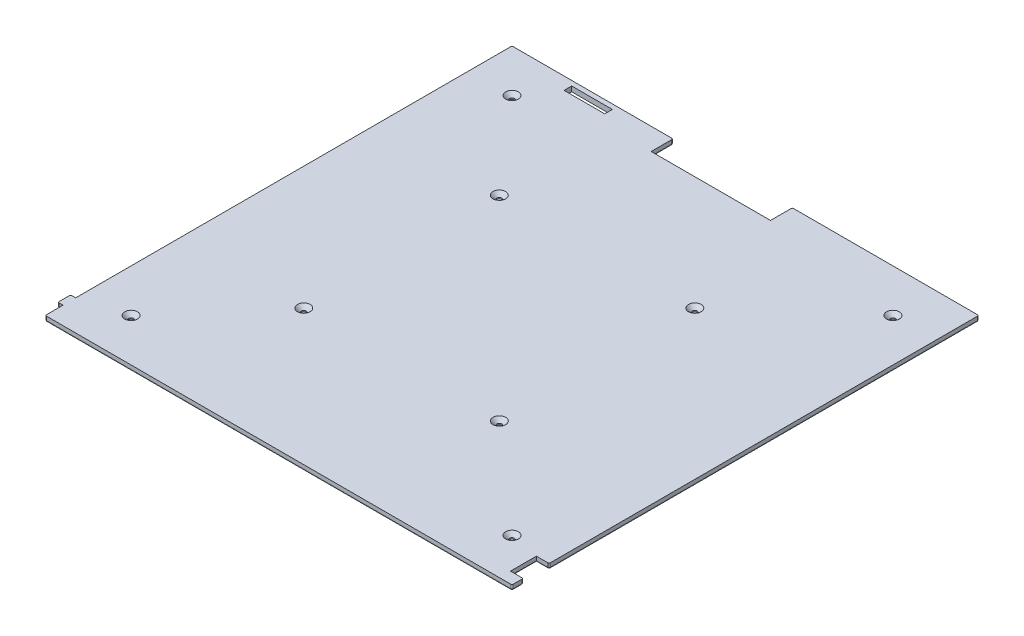
from build123d import *

# Parameters (mm, degrees)
BOSS_EXTRUDE1_DEPTH = 2
SKETCH2_R           = 1
CUT_EXTRUDE1_DEPTH  = 136.739493148
CHAMFER1_SIZE       = 1.5
CHAMFER2_SIZE       = 1.5
FILLET1_R           = 0.5
FILLET2_R           = 0.5
SKETCH3_W           = 16
SKETCH3_H           = 3
CUT_EXTRUDE2_DEPTH  = 136.739493148


with BuildPart() as part:
    # Sketch1 → Boss-Extrude1 (new body)
    with BuildSketch(Plane(origin=(0, 0, 0), x_dir=(1, 0, 0), z_dir=(0, 1, 0))):
        Polygon((-91.9, 85.8), (-91.9, -86), (-93.9, -86), (-93.9, -91), (-91.9, -91), (-91.9, -98), (91.9, -98), (91.9, -93.6), (86.9, -93.6), (86.9, -83.4), (91.9, -83.4), (91.9, 85.8), (18.5, 85.8), (18.5, 77.2), (-28.5, 77.2), (-28.5, 85.8), align=None)
    extrude(amount=BOSS_EXTRUDE1_DEPTH)

    # Sketch2 → Cut-Extrude1 (cut, through all)
    with BuildSketch(Plane.XZ):
        with Locations(Location((75, -68.9, 0), (0, 0, 270))):
            Circle(SKETCH2_R)
        with Locations(Location((-75, -68.9, 0), (0, 0, 270))):
            Circle(SKETCH2_R)
        with Locations(Location((-75, 81.1, 0), (0, 0, 270))):
            Circle(SKETCH2_R)
        with Locations(Location((75, 81.1, 0), (0, 0, 270))):
            Circle(SKETCH2_R)
        with Locations(Location((33.5, -32.4, 0), (0, 0, 270))):
            Circle(SKETCH2_R)
        with Locations(Location((-43.5, -32.4, 0), (0, 0, 270))):
            Circle(SKETCH2_R)
        with Locations(Location((-43.5, 44.6, 0), (0, 0, 270))):
            Circle(SKETCH2_R)
        with Locations(Location((33.5, 44.6, 0), (0, 0, 270))):
            Circle(SKETCH2_R)
    extrude(amount=-CUT_EXTRUDE1_DEPTH, mode=Mode.SUBTRACT)

    # Chamfer1
    chamfer1_edges = [part.edges().sort_by_distance(p)[0] for p in [
        (-75, 2, -67.9),
    ]]
    chamfer(chamfer1_edges, length=CHAMFER1_SIZE)

    # Chamfer2
    chamfer2_edges = [part.edges().sort_by_distance(p)[0] for p in [
        (-75, 2, 82.1),
        (75, 2, 82.1),
        (33.5, 2, -31.4),
        (-43.5, 2, -31.4),
        (-43.5, 2, 45.6),
        (33.5, 2, 45.6),
        (75, 2, -67.9),
    ]]
    chamfer(chamfer2_edges, length=CHAMFER2_SIZE)

    # Fillet1
    fillet1_edges = [part.edges().sort_by_distance(p)[0] for p in [
        (-28.5, 0, -81.5),
        (-5, 0, -77.2),
        (18.5, 0, -81.5),
        (55.2, 0, -85.8),
        (91.9, 0, -1.2),
        (89.4, 0, 83.4),
        (86.9, 0, 88.5),
        (89.4, 0, 93.6),
        (91.9, 0, 95.8),
        (0, 0, 98),
        (-91.9, 0, 94.5),
        (-92.9, 0, 91),
        (-93.9, 0, 88.5),
        (-92.9, 0, 86),
        (-91.9, 0, 0.1),
        (-60.2, 0, -85.8),
    ]]
    fillet(fillet1_edges, radius=FILLET1_R)

    # Fillet2
    # the kernel refuses this fillet: 0.5 mm, written as the material it takes off along each edge
    with BuildSketch(Plane(origin=(91.4, 0.5, 82.9), x_dir=(0, 0, 1), z_dir=(1, 0, 0))) as fillet2_piece_1_section:
        Polygon((0, 0), (FILLET2_R, 0), (FILLET2_R, FILLET2_R), (0, FILLET2_R), align=None)
    fillet2_piece_1 = extrude(amount=FILLET2_R, mode=Mode.PRIVATE)
    fillet2_piece_1 = fillet2_piece_1 - Plane(origin=(91.4, 0.5, 82.9), x_dir=(0, 0.7071067811865475, -0.7071067811865475), z_dir=(1, 0, 0)) * Sphere(FILLET2_R, mode=Mode.PRIVATE)
    add(fillet2_piece_1, mode=Mode.SUBTRACT)
    with BuildSketch(Plane(origin=(91.4, 0.5, 94.1), x_dir=(0, 0, -1), z_dir=(1, 0, 0))) as fillet2_piece_2_section:
        Polygon((0, 0), (FILLET2_R, 0), (FILLET2_R, -FILLET2_R), (0, -FILLET2_R), align=None)
    fillet2_piece_2 = extrude(amount=FILLET2_R, mode=Mode.PRIVATE)
    fillet2_piece_2 = fillet2_piece_2 - Plane(origin=(91.4, 0.5, 94.1), x_dir=(0, 0.7071067811865475, 0.7071067811865475), z_dir=(1, 0, 0)) * Sphere(FILLET2_R, mode=Mode.PRIVATE)
    add(fillet2_piece_2, mode=Mode.SUBTRACT)
    with BuildSketch(Plane(origin=(91.4, 0.5, -85.3), x_dir=(1, 0, 0), z_dir=(0, 0, -1))) as fillet2_piece_3_section:
        Polygon((0, 0), (FILLET2_R, 0), (FILLET2_R, FILLET2_R), (0, FILLET2_R), align=None)
    fillet2_piece_3 = extrude(amount=FILLET2_R, mode=Mode.PRIVATE)
    fillet2_piece_3 = fillet2_piece_3 - Plane(origin=(91.4, 0.5, -85.3), x_dir=(-0.7071067811865475, 0.7071067811865475, 0), z_dir=(0, 0, -1)) * Sphere(FILLET2_R, mode=Mode.PRIVATE)
    add(fillet2_piece_3, mode=Mode.SUBTRACT)
    with BuildSketch(Plane(origin=(91.4, 0.5, 97.5), x_dir=(1, 0, 0), z_dir=(0, 0, 1))) as fillet2_piece_4_section:
        Polygon((0, 0), (FILLET2_R, 0), (FILLET2_R, -FILLET2_R), (0, -FILLET2_R), align=None)
    fillet2_piece_4 = extrude(amount=FILLET2_R, mode=Mode.PRIVATE)
    fillet2_piece_4 = fillet2_piece_4 - Plane(origin=(91.4, 0.5, 97.5), x_dir=(-0.7071067811865475, 0.7071067811865475, 0), z_dir=(0, 0, 1)) * Sphere(FILLET2_R, mode=Mode.PRIVATE)
    add(fillet2_piece_4, mode=Mode.SUBTRACT)
    with BuildSketch(Plane(origin=(19, 0.5, -85.3), x_dir=(0, 0, -1), z_dir=(-1, 0, 0))) as fillet2_piece_5_section:
        Polygon((0, 0), (FILLET2_R, 0), (FILLET2_R, FILLET2_R), (0, FILLET2_R), align=None)
    fillet2_piece_5 = extrude(amount=FILLET2_R, mode=Mode.PRIVATE)
    fillet2_piece_5 = fillet2_piece_5 - Plane(origin=(19, 0.5, -85.3), x_dir=(0, 0.7071067811865475, 0.7071067811865475), z_dir=(-1, 0, 0)) * Sphere(FILLET2_R, mode=Mode.PRIVATE)
    add(fillet2_piece_5, mode=Mode.SUBTRACT)
    with BuildSketch(Plane(origin=(-91.4, 0.5, 97.5), x_dir=(0, 0, 1), z_dir=(-1, 0, 0))) as fillet2_piece_6_section:
        Polygon((0, 0), (FILLET2_R, 0), (FILLET2_R, -FILLET2_R), (0, -FILLET2_R), align=None)
    fillet2_piece_6 = extrude(amount=FILLET2_R, mode=Mode.PRIVATE)
    fillet2_piece_6 = fillet2_piece_6 - Plane(origin=(-91.4, 0.5, 97.5), x_dir=(0, 0.7071067811865475, -0.7071067811865475), z_dir=(-1, 0, 0)) * Sphere(FILLET2_R, mode=Mode.PRIVATE)
    add(fillet2_piece_6, mode=Mode.SUBTRACT)
    with BuildSketch(Plane(origin=(-93.4, 0.5, 90.5), x_dir=(0, 0, 1), z_dir=(-1, 0, 0))) as fillet2_piece_7_section:
        Polygon((0, 0), (FILLET2_R, 0), (FILLET2_R, -FILLET2_R), (0, -FILLET2_R), align=None)
    fillet2_piece_7 = extrude(amount=FILLET2_R, mode=Mode.PRIVATE)
    fillet2_piece_7 = fillet2_piece_7 - Plane(origin=(-93.4, 0.5, 90.5), x_dir=(0, 0.7071067811865475, -0.7071067811865475), z_dir=(-1, 0, 0)) * Sphere(FILLET2_R, mode=Mode.PRIVATE)
    add(fillet2_piece_7, mode=Mode.SUBTRACT)
    with BuildSketch(Plane(origin=(-29, 0.5, -85.3), x_dir=(1, 0, 0), z_dir=(0, 0, -1))) as fillet2_piece_8_section:
        Polygon((0, 0), (FILLET2_R, 0), (FILLET2_R, FILLET2_R), (0, FILLET2_R), align=None)
    fillet2_piece_8 = extrude(amount=FILLET2_R, mode=Mode.PRIVATE)
    fillet2_piece_8 = fillet2_piece_8 - Plane(origin=(-29, 0.5, -85.3), x_dir=(-0.7071067811865475, 0.7071067811865475, 0), z_dir=(0, 0, -1)) * Sphere(FILLET2_R, mode=Mode.PRIVATE)
    add(fillet2_piece_8, mode=Mode.SUBTRACT)
    with BuildSketch(Plane(origin=(-93.4, 0.5, 86.5), x_dir=(-1, 0, 0), z_dir=(0, 0, -1))) as fillet2_piece_9_section:
        Polygon((0, 0), (FILLET2_R, 0), (FILLET2_R, -FILLET2_R), (0, -FILLET2_R), align=None)
    fillet2_piece_9 = extrude(amount=FILLET2_R, mode=Mode.PRIVATE)
    fillet2_piece_9 = fillet2_piece_9 - Plane(origin=(-93.4, 0.5, 86.5), x_dir=(0.7071067811865475, 0.7071067811865475, 0), z_dir=(0, 0, -1)) * Sphere(FILLET2_R, mode=Mode.PRIVATE)
    add(fillet2_piece_9, mode=Mode.SUBTRACT)
    with BuildSketch(Plane(origin=(-91.4, 0.5, -85.3), x_dir=(0, 0, -1), z_dir=(-1, 0, 0))) as fillet2_piece_10_section:
        Polygon((0, 0), (FILLET2_R, 0), (FILLET2_R, FILLET2_R), (0, FILLET2_R), align=None)
    fillet2_piece_10 = extrude(amount=FILLET2_R, mode=Mode.PRIVATE)
    fillet2_piece_10 = fillet2_piece_10 - Plane(origin=(-91.4, 0.5, -85.3), x_dir=(0, 0.7071067811865475, 0.7071067811865475), z_dir=(-1, 0, 0)) * Sphere(FILLET2_R, mode=Mode.PRIVATE)
    add(fillet2_piece_10, mode=Mode.SUBTRACT)
    with BuildSketch(Plane(origin=(-28.5, 0.5, -85.8), x_dir=(-1, 0, 0), z_dir=(0, 1, 0)), Plane(origin=(18.5, 0.5, -85.8), x_dir=(0, 0, 1), z_dir=(0, 1, 0)), Plane(origin=(91.9, 0.5, -85.8), x_dir=(-1, 0, 0), z_dir=(0, 1, 0)), Plane(origin=(91.9, 0.5, 83.4), x_dir=(0, 0, -1), z_dir=(0, 1, 0)), Plane(origin=(-91.9, 0.5, -85.8), x_dir=(0, 0, 1), z_dir=(0, 1, 0))) as fillet2_piece_11:
        with BuildLine():
            CenterArc((FILLET2_R, FILLET2_R), FILLET2_R, 180, 90)
            Line((0, FILLET2_R), (0, 0))
            Line((0, 0), (FILLET2_R, 0))
        make_face()
    extrude(amount=2.75, mode=Mode.SUBTRACT)
    with BuildSketch(Plane(origin=(91.9, 0.5, 93.6), x_dir=(0, 0, 1), z_dir=(0, 1, 0)), Plane(origin=(91.9, 0.5, 98), x_dir=(-1, 0, 0), z_dir=(0, 1, 0)), Plane(origin=(-91.9, 0.5, 98), x_dir=(0, 0, -1), z_dir=(0, 1, 0)), Plane(origin=(-93.9, 0.5, 91), x_dir=(0, 0, -1), z_dir=(0, 1, 0)), Plane(origin=(-93.9, 0.5, 86), x_dir=(1, 0, 0), z_dir=(0, 1, 0))) as fillet2_piece_12:
        with BuildLine():
            CenterArc((FILLET2_R, -FILLET2_R), FILLET2_R, 90, 90)
            Line((0, -FILLET2_R), (0, 0))
            Line((0, 0), (FILLET2_R, 0))
        make_face()
    extrude(amount=2.75, mode=Mode.SUBTRACT)

    # Sketch3 → Cut-Extrude2 (cut, through all)
    with BuildSketch(Plane.XZ):
        with Locations((-58.5, -82.4)):
            Rectangle(SKETCH3_W, SKETCH3_H)
    extrude(amount=-CUT_EXTRUDE2_DEPTH, mode=Mode.SUBTRACT)


solid = part.part
